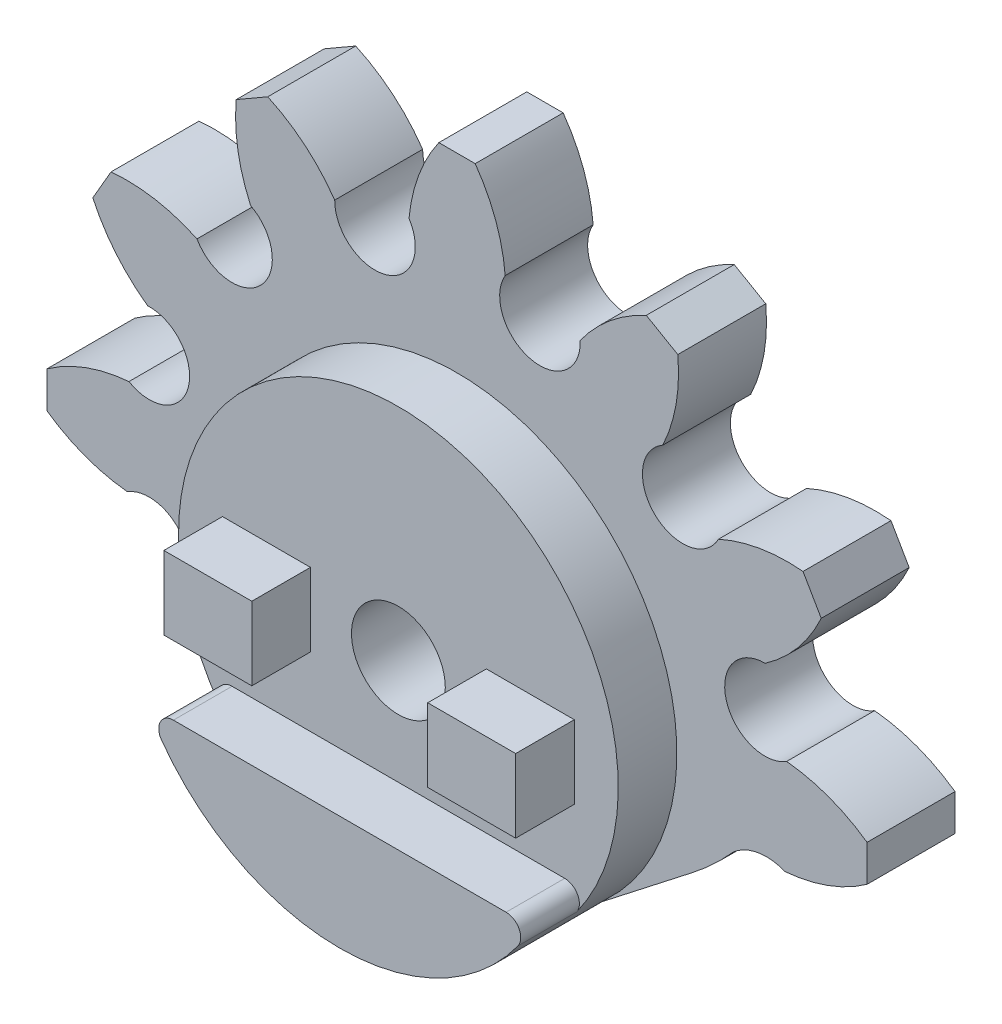
from build123d import *

# Parameters (mm, degrees)
SKETCH1_R           = 1.5999994277954093
BOSS_EXTRUDE1_DEPTH = 3
SKETCH2_R           = 7.499999999999997
SKETCH2_R_2         = 1.5999994277954093
BOSS_EXTRUDE2_DEPTH = 2
SKETCH3_W           = 3
SKETCH3_H           = 2.4999990463256836
SKETCH3_W_2         = 2.999998092651367
BOSS_EXTRUDE3_DEPTH = 2
FILLET1_R           = 0.5
FILLET2_R           = 0.5


with BuildPart() as part:
    # Sketch1 → Boss-Extrude1 (new body)
    with BuildSketch(Plane.XY):
        with BuildLine():
            ThreePointArc((2.9496066570281987, 9.186273574829102), (1.4826895125555999, 8.863812001462453), (0.1537669450044632, 8.163960456848145))
            Line((0.1537669450044632, 8.163960456848145), (0.1537669450044632, 6.922550678253174))
            ThreePointArc((0.1537669450044632, 6.922550678253174), (1.4591954710477617, 6.235236889390279), (2.897086284729771, 5.905064375547086))
            ThreePointArc((2.897086284729774, 5.905064375547072), (3.8623065069054006, 6.101359542352135), (4.711058856837534, 5.601558263549775))
            ThreePointArc((4.711058856837534, 5.601558263549774), (4.714668989326369, 5.598407805328139), (4.718270301818848, 5.595247268676758))
            ThreePointArc((4.7182703018188485, 5.595247268676757), (5.393644685511456, 4.899905769989473), (6.133169651031494, 4.273221492767334))
            Line((6.133169651031494, 4.273221492767334), (9.531226350959459, 1.6263983387561165))
            ThreePointArc((9.531226350959457, 1.6263983387561156), (14.140000343322752, 0.04325580596924006), (18.748774335686047, 1.6263983387561183))
            Line((18.748774335686047, 1.62639833875612), (22.14683103561401, 4.273221492767336))
            ThreePointArc((22.14683103561401, 4.273221492767337), (22.886356001134054, 4.899905769989471), (23.56173038482666, 5.595247268676759))
            ThreePointArc((23.56173038482666, 5.595247268676759), (24.402958445676255, 5.997704500562882), (25.330394029617306, 5.900238037109375))
            ThreePointArc((25.330394029617306, 5.900238037109373), (26.79731117408991, 6.222699610476017), (28.12623374164104, 6.922551155090333))
            Line((28.12623374164104, 6.922551155090334), (28.12623374164104, 8.163960933685305))
            ThreePointArc((28.12623374164104, 8.163960933685306), (26.820805215597755, 8.851274722548194), (25.38291440191576, 9.181447236391389))
            ThreePointArc((25.382914401915755, 9.181447236391417), (23.32365030135076, 9.960310627730676), (24.652674438432754, 11.715557522414645))
            ThreePointArc((24.652674438432754, 11.715557522414645), (25.761831164109633, 12.728276008930756), (26.5627860949642, 13.9988265092201))
            Line((26.5627860949642, 13.9988265092201), (25.94208120566671, 15.073918913989761))
            ThreePointArc((25.94208120566671, 15.073918913989761), (24.467890044856905, 15.016435852494713), (23.057553815418423, 14.583428230273288))
            ThreePointArc((23.05755381541841, 14.583428230273306), (20.88474709555818, 14.228311662968322), (21.1580923131719, 16.412912132219382))
            ThreePointArc((21.1580923131719, 16.412912132219382), (21.612290971128385, 17.844530431262903), (21.670663038390177, 19.345336906731784))
            Line((21.670663038390177, 19.345336906731784), (20.595570633620518, 19.966041796029266))
            ThreePointArc((20.595570633620518, 19.966041796029266), (19.347625169072252, 19.179164424082327), (18.34274197761166, 18.099000708487008))
            ThreePointArc((18.34274197761168, 18.099000708486997), (16.638594444351643, 16.70505737996612), (15.78301811218261, 18.733649492263794))
            ThreePointArc((15.783018112182614, 18.73364949226379), (15.460556538815972, 20.20056663673639), (14.760704994201657, 21.529489204287525))
            Line((14.760704994201657, 21.529489204287525), (13.519295215606686, 21.529489204287525))
            ThreePointArc((13.519295215606686, 21.529489204287525), (12.831981426743802, 20.224060678244246), (12.501808912900602, 18.78616986456226))
            ThreePointArc((12.501808912900572, 18.78616986456225), (11.722945521561316, 16.726905763997248), (9.967698626877342, 18.055929901079246))
            ThreePointArc((9.967698626877342, 18.055929901079246), (8.954980140361231, 19.165086626756125), (7.684429640071889, 19.96604155761069))
            Line((7.6844296400718894, 19.96604155761069), (6.609337235302229, 19.345336668313205))
            ThreePointArc((6.609337235302228, 19.345336668313205), (6.666820296797276, 17.8711455075034), (7.099827919018696, 16.460809278064914))
            ThreePointArc((7.099827919018679, 16.4608092780649), (7.454944486323676, 14.288002558204665), (5.270344017072608, 14.561347775818387))
            ThreePointArc((5.270344017072609, 14.561347775818387), (3.8387257180290857, 15.01554643377487), (2.3379192425602042, 15.073918501036662))
            Line((2.3379192425602042, 15.073918501036662), (1.7172143532627213, 13.998826096267006))
            ThreePointArc((1.7172143532627215, 13.998826096267006), (2.504091725209663, 12.750880631718738), (3.584255440804986, 11.745997440258147))
            ThreePointArc((3.584255440804995, 11.745997440258172), (4.978198769325871, 10.04184990699813), (2.9496066570281982, 9.186273574829102))
        make_face()
        with Locations((14.140000343322754, 7.543255805969239)):
            Circle(SKETCH1_R, mode=Mode.SUBTRACT)
    extrude(amount=BOSS_EXTRUDE1_DEPTH)

    # Sketch2 → Boss-Extrude2 (add)
    with BuildSketch(Plane.XY.offset(3)):
        with Locations((14.140000343322754, 7.543255805969239)):
            Circle(SKETCH2_R)
        with Locations((14.140000343322754, 7.543255805969239)):
            Circle(SKETCH2_R_2, mode=Mode.SUBTRACT)
    extrude(amount=BOSS_EXTRUDE2_DEPTH)

    # Sketch3 → Boss-Extrude3 (add)
    with BuildSketch(Plane.XY.offset(5)):
        with Locations((9.640000343322754, 7.54325532913208)):
            Rectangle(SKETCH3_W, SKETCH3_H)
        with Locations((18.640000343322754, 7.54325532913208)):
            Rectangle(SKETCH3_W_2, SKETCH3_H)
        with BuildLine():
            Line((7.560486761755216, 3.943255662918091), (20.71951392489029, 3.943255662918091))
            ThreePointArc((20.71951392489029, 3.943255662918091), (14.140000343322754, 0.04325580596924095), (7.560486761755216, 3.943255662918091))
        make_face()
    extrude(amount=BOSS_EXTRUDE3_DEPTH)

    # Fillet1
    fillet1_edges = [part.edges().sort_by_distance(p)[0] for p in [
        (20.71951392489029, 3.943255662918091, 6),
    ]]
    fillet(fillet1_edges, radius=FILLET1_R)

    # Fillet2
    fillet2_edges = [part.edges().sort_by_distance(p)[0] for p in [
        (7.560486761755216, 3.943255662918091, 6),
    ]]
    fillet(fillet2_edges, radius=FILLET2_R)


solid = part.part
